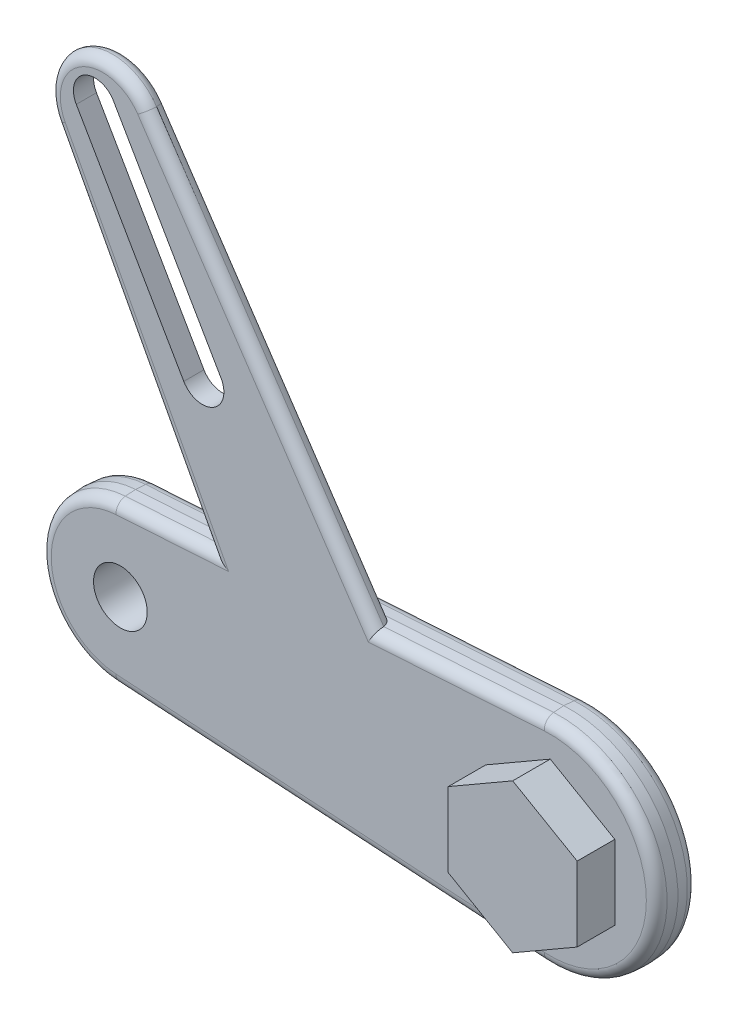
from build123d import *

# Parameters (mm, degrees)
EXTRUDE_313_DEPTH           = 3.75
EXTRUDE_313_TAPER           = 4.000000000000009
EXTRUDE_313_OTHER_WAY_DEPTH = 3.75
EXTRUDE_313_OTHER_WAY_TAPER = 4.000000000000009
EXTRUDE_604_DEPTH           = 3.75
EXTRUDE_604_TAPER           = 4.000000000000009
CUT_EXTRUDE_1_DEPTH         = 109.586836915909
SKETCH_4_R                  = 5.000000000000001
CUT_EXTRUDE_2_DEPTH         = 109.586836915909
EXTRUDE_4_DEPTH             = 7
FILLET_1_R                  = 2
FILLET_2_R                  = 2


with BuildPart() as part:
    # Эскиз1 → Extrude 313 (new body)
    with BuildSketch(Plane.XY):
        with BuildLine():
            ThreePointArc((-33.78207478005865, 14.970674458754354), (-47.84457478005865, 1.84e-15), (-33.78207478005865, -14.970674458754353))
            Line((-33.78207478005865, -14.970674458754353), (45.90542521994135, -19.960899278339138))
            ThreePointArc((45.90542521994135, -19.960899278339138), (67.15542521994135, 0), (45.90542521994135, 19.96089927833915))
            Line((45.90542521994135, 19.96089927833915), (-33.78207478005865, 14.970674458754354))
        make_face()
    extrude(amount=EXTRUDE_313_DEPTH, taper=EXTRUDE_313_TAPER)

    # Эскиз1 → Extrude 313 other way (add)
    with BuildSketch(Plane.XY):
        with BuildLine():
            ThreePointArc((-33.78207478005865, 14.970674458754354), (-47.84457478005865, 1.84e-15), (-33.78207478005865, -14.970674458754353))
            Line((-33.78207478005865, -14.970674458754353), (45.90542521994135, -19.960899278339138))
            ThreePointArc((45.90542521994135, -19.960899278339138), (67.15542521994135, 0), (45.90542521994135, 19.96089927833915))
            Line((45.90542521994135, 19.96089927833915), (-33.78207478005865, 14.970674458754354))
        make_face()
    extrude(amount=-EXTRUDE_313_OTHER_WAY_DEPTH, taper=EXTRUDE_313_OTHER_WAY_TAPER)

    # Эскиз2 → Extrude 604 (add, through all)
    with BuildSketch(Plane.XY):
        with BuildLine():
            Line((-44.97532089787029, 70.30528437214097), (-7.5933381015594845, 6.94e-15))
            Line((-7.5933381015594845, 6.94e-15), (26.39163556671457, 0.16728878792131394))
            Line((26.39163556671457, 0.16728878792131394), (-27.855469243730653, 80.59192903470745))
            ThreePointArc((-27.855469243730653, 80.59192903470745), (-41.29622571838166, 83.57167300702109), (-44.97532089787029, 70.30528437214097))
        make_face()
    extrude(amount=EXTRUDE_604_DEPTH, taper=EXTRUDE_604_TAPER)

    # Эскиз3 → Вырез-Вытянуть1 (cut, through all)
    with BuildSketch(Plane.XY.offset(3.75)):
        with BuildLine():
            Line((-34.119324442658446, 79.26930388139459), (-14.119324442658357, 44.62828773001714))
            ThreePointArc((-14.119324442658357, 44.62828773001714), (-15.58342605779593, 39.16418611487918), (-21.04752767293403, 40.62828773001693))
            Line((-21.04752767293403, 40.62828773001693), (-41.04752767293395, 75.26930388139452))
            ThreePointArc((-41.04752767293395, 75.26930388139452), (-39.583426057796224, 80.73340549653236), (-34.119324442658446, 79.26930388139459))
        make_face()
    extrude(amount=-CUT_EXTRUDE_1_DEPTH, mode=Mode.SUBTRACT)

    # Эскиз4 → Вырез-Вытянуть2 (cut, through all)
    with BuildSketch(Plane.XY.offset(3.75)):
        with Locations((-32.84457478005865, 0)):
            Circle(SKETCH_4_R)
    extrude(amount=-CUT_EXTRUDE_2_DEPTH, mode=Mode.SUBTRACT)

    # Эскиз6 → Бобышка-Вытянуть4 (add)
    with BuildSketch(Plane.XY.offset(3.75)):
        Polygon((47.15542521994136, 13.85640646055103), (35.15542521994135, 6.928203230275517), (35.15542521994135, -6.928203230275513), (47.15542521994134, -13.856406460551026), (59.15542521994136, -6.928203230275509), (59.15542521994136, 6.9282032302755185), align=None)
    extrude(amount=EXTRUDE_4_DEPTH)

    # Скругление1
    fillet_1_edges = [part.edges().sort_by_distance(p)[0] for p in [
        (-47.582349235270485, -7.8e-16, -3.75),
        (66.8931996751532, 7.99e-15, 3.7499999999999996),
        (30.080486304539015, 18.707163953539766, 3.75),
        (-47.582349235270485, 2.33e-15, 3.7499999999999996),
        (6.078064316490606, -17.204073984160548, 3.7500000000000004),
        (6.078064316490607, -17.204073984160537, -3.75),
        (-24.741927783764027, 15.274051213737346, 3.7499999999999996),
        (-6.916852890128096, 49.0802179420399, 3.7500000000000058),
        (-41.16116957860173, 83.34690184461988, 3.7499999999999996),
        (-30.23097968416606, 43.13376633078081, 3.750000000000007),
        (66.89319967515318, -5.55e-15, -3.75),
        (6.078064316490607, 17.20407398416054, -3.75),
    ]]
    fillet(fillet_1_edges, radius=FILLET_1_R)

    # Скругление2
    # the kernel refuses this fillet: 2 mm, written as the material it takes off along each edge
    with BuildSketch(Plane(origin=(-44.97532089787029, 70.30528437214097, 0), x_dir=(0.06159131057865614, 0.03274868074306383, 0.9975640502598279), z_dir=(0.46947156278590146, -0.8829475928589213, 0))) as fillet_2_piece_1_section:
        with BuildLine():
            CenterArc((2.1436447558512195, -1.98437417397325), FILLET_2_R, 97.16683307666736, 86.83316692332966)
            Line((0.1485166553315637, -2.123887121461397), (0.10861409332117057, -2.12667738041116))
            Line((0.10861409332117057, -2.12667738041116), (-0.03990256201039311, -0.00279025894976294))
            Line((-0.03990256201039311, -0.00279025894976294), (1.96e-15, 0.04000000000000188))
            ThreePointArc((1.96e-15, 0.04000000000000188), (0.9470634727645385, 0.04000000000004966), (1.8891365893226297, 0.03968748347946698))
            Line((1.8891365893226297, 0.03968748347946698), (1.894126945529073, 0))
        make_face()
    fillet_2_piece_1 = extrude(amount=66.74180982875873, mode=Mode.PRIVATE)
    fillet_2_piece_1 = split(fillet_2_piece_1, bisect_by=Plane(origin=(-41.49695385970438, 14.76021709060138, 3.8916978839733556), z_dir=(-0.06234775314123914, 0.9956137765464197, -0.06975647374412589)), keep=Keep.TOP, mode=Mode.PRIVATE)
    with BuildSketch(Plane(origin=(-44.97532089787029, 70.30528437214097, 0), x_dir=(0.06159131057865614, 0.03274868074306383, 0.9975640502598279), z_dir=(0.46947156278590146, -0.8829475928589213, 0))) as fillet_2_piece_2_section:
        with BuildLine():
            CenterArc((2.1436447558512195, -1.98437417397325), FILLET_2_R, 97.16683307666736, 86.83316692332966)
            Line((0.1485166553315637, -2.123887121461397), (0.10861409332117057, -2.12667738041116))
            Line((0.10861409332117057, -2.12667738041116), (-0.03990256201039311, -0.00279025894976294))
            Line((-0.03990256201039311, -0.00279025894976294), (1.96e-15, 0.04000000000000188))
            ThreePointArc((1.96e-15, 0.04000000000000188), (0.9470634727645385, 0.04000000000004966), (1.8891365893226297, 0.03968748347946698))
            Line((1.8891365893226297, 0.03968748347946698), (1.894126945529073, 0))
        make_face()
    fillet_2_piece_2 = extrude(amount=66.74180982875873, mode=Mode.PRIVATE)
    fillet_2_piece_2 = split(fillet_2_piece_2, bisect_by=Plane(origin=(-41.49695385970437, 14.760217090601344, -3.891697883973335), z_dir=(-0.062347753141239255, 0.9956137765464199, 0.0697564737441255)), keep=Keep.TOP, mode=Mode.PRIVATE)
    fillet_2_piece_2 = split(fillet_2_piece_2, bisect_by=Plane(origin=(-41.49695385970438, 14.76021709060138, 3.8916978839733556), z_dir=(0.06234775314123914, -0.9956137765464197, 0.06975647374412589)), keep=Keep.TOP, mode=Mode.PRIVATE)
    with BuildSketch(Plane(origin=(-44.97532089787029, 70.30528437214097, 0), x_dir=(0.06159131057865614, 0.03274868074306383, 0.9975640502598279), z_dir=(0.46947156278590146, -0.8829475928589213, 0))) as fillet_2_piece_3_section:
        with BuildLine():
            CenterArc((2.1436447558512195, -1.98437417397325), FILLET_2_R, 97.16683307666736, 86.83316692332966)
            Line((0.1485166553315637, -2.123887121461397), (0.10861409332117057, -2.12667738041116))
            Line((0.10861409332117057, -2.12667738041116), (-0.03990256201039311, -0.00279025894976294))
            Line((-0.03990256201039311, -0.00279025894976294), (1.96e-15, 0.04000000000000188))
            ThreePointArc((1.96e-15, 0.04000000000000188), (0.9470634727645385, 0.04000000000004966), (1.8891365893226297, 0.03968748347946698))
            Line((1.8891365893226297, 0.03968748347946698), (1.894126945529073, 0))
        make_face()
    fillet_2_piece_3 = extrude(amount=66.74180982875873, mode=Mode.PRIVATE)
    fillet_2_piece_3 = split(fillet_2_piece_3, bisect_by=Plane(origin=(-41.49695385970437, 14.760217090601344, -3.891697883973335), z_dir=(0.062347753141239255, -0.9956137765464199, -0.0697564737441255)), keep=Keep.TOP, mode=Mode.PRIVATE)
    fillet_2_piece_3 = split(fillet_2_piece_3, bisect_by=Plane(origin=(-41.49695385970438, 14.760217090601387, 3.8916978839733547), z_dir=(-0.06234775314123914, 0.9956137765464197, -0.06975647374412589)), keep=Keep.TOP, mode=Mode.PRIVATE)
    with BuildSketch(Plane(origin=(-36.14584496928108, 74.99999999999999, 0), x_dir=(0.8290375725550423, 0.559192903470746, 0), z_dir=(0.559192903470746, -0.8290375725550423, 0))) as fillet_2_piece_4:
        with BuildLine():
            CenterArc((7.870930249758116, 2), FILLET_2_R, 270, 86.83316692332944)
            Line((9.867876070562296, 1.8895129474882502), (9.907814986978373, 1.887303206438015))
            ThreePointArc((9.907814986978373, 1.887303206438015), (9.973838762709134, 0.9475466044073921), (10.039902562010383, 0.00279025894976502))
            Line((10.039902562010383, 0.00279025894976502), (9.999999999999998, -0.04))
            Line((9.999999999999998, -0.04), (7.870930249758116, -0.04))
            Line((7.870930249758116, -0.04), (7.870930249758116, 0))
        make_face()
    fillet_2_piece_4_solid = revolve(axis=Axis((-36.14584496928108, 74.99999999999999, 0), (0, 0, 1)), revolution_arc=174.00000000000074, mode=Mode.PRIVATE)
    with BuildSketch(Plane(origin=(17.34900989046163, 13.5735326684051, 0), x_dir=(-0.057830737662793216, -0.03900732508883394, 0.9975640502598272), z_dir=(-0.5591929034707452, 0.8290375725550428, 0))) as fillet_2_piece_5_section:
        with BuildLine():
            CenterArc((2.1436447558512377, -1.9843741739732534), FILLET_2_R, 97.16683307666793, 86.8331669233296)
            Line((0.14851665533158329, -2.1238871214614172), (0.1086140933211902, -2.1266773804111807))
            Line((0.1086140933211902, -2.1266773804111807), (-0.03990256201039322, -0.00279025894976136))
            Line((-0.03990256201039322, -0.00279025894976136), (1.63e-15, 0.04000000000000167))
            ThreePointArc((1.63e-15, 0.04000000000000167), (0.9470634727645375, 0.04000000000004274), (1.8891365893226273, 0.03968748347946384))
            Line((1.8891365893226273, 0.03968748347946384), (1.8941269455290706, 2e-17))
        make_face()
    fillet_2_piece_5 = extrude(amount=80.8387925769827, mode=Mode.PRIVATE)
    fillet_2_piece_5 = split(fillet_2_piece_5, bisect_by=Plane(origin=(17.06352440073483, 18.13237035309626, 0.31940944244362984), z_dir=(-0.062347753141239255, 0.9956137765464199, 0.0697564737441255)), keep=Keep.TOP, mode=Mode.PRIVATE)
    fillet_2_piece_5 = split(fillet_2_piece_5, bisect_by=Plane(origin=(17.06352440073483, 18.132370353096263, -0.31940944244363195), z_dir=(0.06234775314123914, -0.9956137765464197, 0.06975647374412589)), keep=Keep.TOP, mode=Mode.PRIVATE)
    with BuildSketch(Plane(origin=(17.34900989046163, 13.5735326684051, 0), x_dir=(-0.057830737662793216, -0.03900732508883394, 0.9975640502598272), z_dir=(-0.5591929034707452, 0.8290375725550428, 0))) as fillet_2_piece_6_section:
        with BuildLine():
            CenterArc((2.1436447558512377, -1.9843741739732534), FILLET_2_R, 97.16683307666793, 86.8331669233296)
            Line((0.14851665533158329, -2.1238871214614172), (0.1086140933211902, -2.1266773804111807))
            Line((0.1086140933211902, -2.1266773804111807), (-0.03990256201039322, -0.00279025894976136))
            Line((-0.03990256201039322, -0.00279025894976136), (1.63e-15, 0.04000000000000167))
            ThreePointArc((1.63e-15, 0.04000000000000167), (0.9470634727645375, 0.04000000000004274), (1.8891365893226273, 0.03968748347946384))
            Line((1.8891365893226273, 0.03968748347946384), (1.8941269455290706, 2e-17))
        make_face()
    fillet_2_piece_6 = extrude(amount=80.8387925769827, mode=Mode.PRIVATE)
    fillet_2_piece_6 = split(fillet_2_piece_6, bisect_by=Plane(origin=(17.06352440073483, 18.132370353096263, 0.31940944244363006), z_dir=(0.062347753141239255, -0.9956137765464199, -0.0697564737441255)), keep=Keep.TOP, mode=Mode.PRIVATE)
    fillet_2_piece_6 = split(fillet_2_piece_6, bisect_by=Plane(origin=(17.06352440073483, 18.132370353096263, -0.31940944244363195), z_dir=(-0.06234775314123914, 0.9956137765464197, -0.06975647374412589)), keep=Keep.TOP, mode=Mode.PRIVATE)
    with BuildSketch(Plane(origin=(17.34900989046163, 13.5735326684051, 0), x_dir=(-0.057830737662793216, -0.03900732508883394, 0.9975640502598272), z_dir=(-0.5591929034707452, 0.8290375725550428, 0))) as fillet_2_piece_7_section:
        with BuildLine():
            CenterArc((2.1436447558512377, -1.9843741739732534), FILLET_2_R, 97.16683307666793, 86.8331669233296)
            Line((0.14851665533158329, -2.1238871214614172), (0.1086140933211902, -2.1266773804111807))
            Line((0.1086140933211902, -2.1266773804111807), (-0.03990256201039322, -0.00279025894976136))
            Line((-0.03990256201039322, -0.00279025894976136), (1.63e-15, 0.04000000000000167))
            ThreePointArc((1.63e-15, 0.04000000000000167), (0.9470634727645375, 0.04000000000004274), (1.8891365893226273, 0.03968748347946384))
            Line((1.8891365893226273, 0.03968748347946384), (1.8941269455290706, 2e-17))
        make_face()
    fillet_2_piece_7 = extrude(amount=80.8387925769827, mode=Mode.PRIVATE)
    fillet_2_piece_7 = split(fillet_2_piece_7, bisect_by=Plane(origin=(17.06352440073483, 18.132370353096263, -0.31940944244363195), z_dir=(-0.06234775314123914, 0.9956137765464197, -0.06975647374412589)), keep=Keep.TOP, mode=Mode.PRIVATE)
    add([fillet_2_piece_1, fillet_2_piece_2, fillet_2_piece_3, fillet_2_piece_4_solid, fillet_2_piece_5, fillet_2_piece_6, fillet_2_piece_7], mode=Mode.SUBTRACT)


solid = part.part
